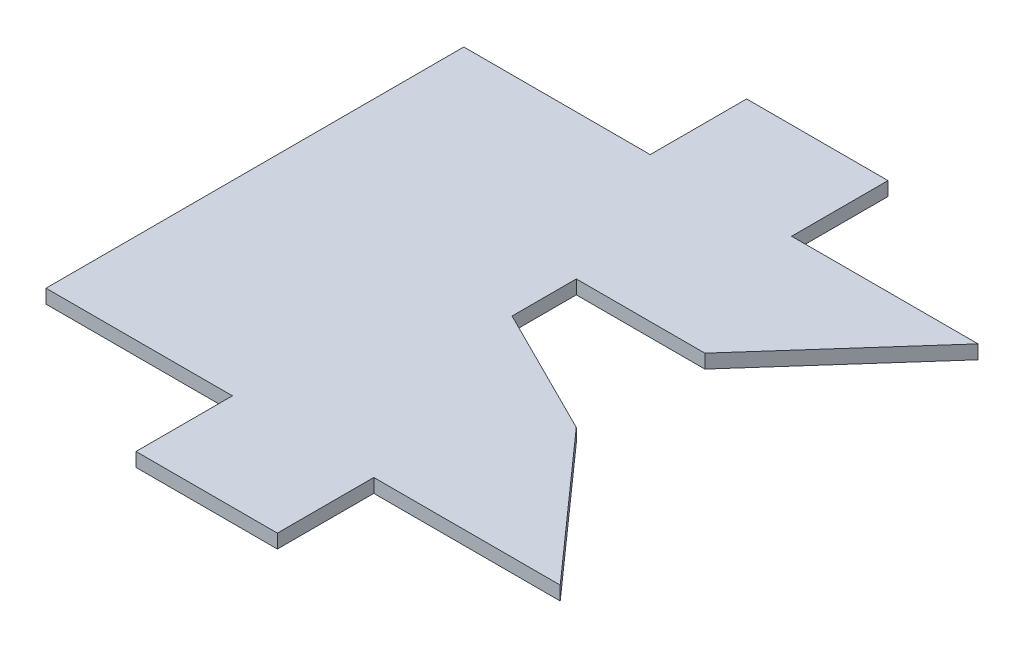
from build123d import *

# Parameters (mm, degrees)
BOSS_EXTRUDE1_DEPTH = 4.3
CUT_EXTRUDE1_DEPTH  = 4.5


with BuildPart() as part:
    # Sketch2 → Boss-Extrude1 (new body)
    with BuildSketch(Plane(origin=(0, 0, 0), x_dir=(1, 0, 0), z_dir=(0, 1, 0))):
        Polygon((0, 0), (0, 65), (58, 65), (58, 95), (102, 95), (102, 65), (160, 65), (160, 0), align=None)
    extrude(amount=BOSS_EXTRUDE1_DEPTH)

    # Mirror1: part across plane


with BuildPart() as part_1:
    add(part.part)
    add(part.part.mirror(Plane(origin=(0, 4.3, 0), x_dir=(1, 0, 0), z_dir=(0, 0, -1))))

    # Sketch3 → Cut-Extrude1 (cut)
    with BuildSketch(Plane(origin=(0, 4.3, 0), x_dir=(1, 0, 0), z_dir=(0, 1, 0))):
        Polygon((160, -65), (160, 65), (120.012594795, 20), (80.012594795, 20), (80.012594795, 0), (120, -20), align=None)
    extrude(amount=-CUT_EXTRUDE1_DEPTH, mode=Mode.SUBTRACT)


solid = part_1.part
